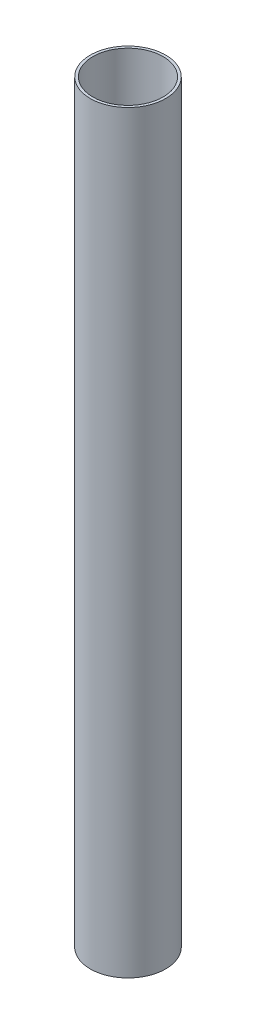
from build123d import *

# Parameters (mm, degrees)
SKETCH1_R           = 29
SKETCH1_R_2         = 27
BOSS_EXTRUDE1_DEPTH = 580


with BuildPart() as part:
    # Sketch1 → Boss-Extrude1 (new body)
    with BuildSketch(Plane(origin=(0, 0, 0), x_dir=(1, 0, 0), z_dir=(0, 1, 0))):
        Circle(SKETCH1_R)
        Circle(SKETCH1_R_2, mode=Mode.SUBTRACT)
    extrude(amount=BOSS_EXTRUDE1_DEPTH)


solid = part.part
